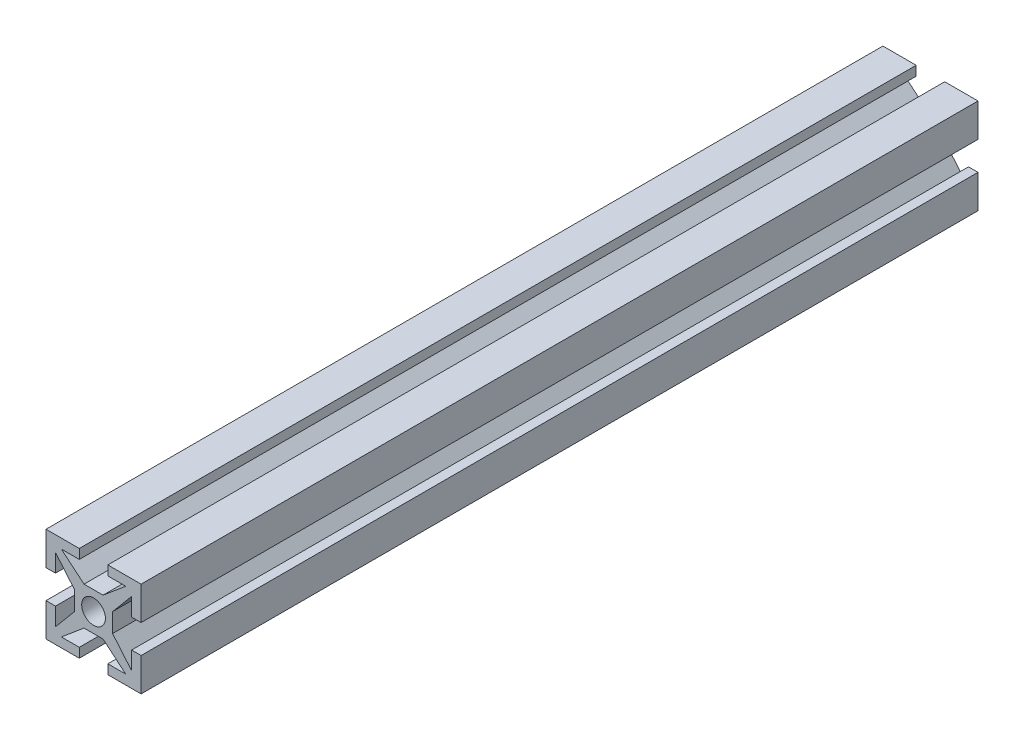
from build123d import *

# Parameters (mm, degrees)
ESQUISSE2_R        = 1.25
BOSS_EXTRU_1_DEPTH = 88


with BuildPart() as part:
    # Esquisse2 → Boss.-Extru.1 (new body)
    with BuildSketch(Plane.XY):
        Polygon((-1, -2), (1, -2), (3.383507185, -4), (1.5, -4), (1.5, -5), (5, -5), (5, -1.5), (4, -1.5), (4, -3.383507185), (2, -1), (2, 1), (4, 3.383507185), (4, 1.5), (5, 1.5), (5, 5), (1.5, 5), (1.5, 4), (3.383507185, 4), (1, 2), (-1, 2), (-3.383507185, 4), (-1.5, 4), (-1.5, 5), (-5, 5), (-5, 1.5), (-4, 1.5), (-4, 3.383507185), (-2, 1), (-2, -1), (-4, -3.383507185), (-4, -1.5), (-5, -1.5), (-5, -5), (-1.5, -5), (-1.5, -4), (-3.383507185, -4), align=None)
        Circle(ESQUISSE2_R, mode=Mode.SUBTRACT)
    extrude(amount=BOSS_EXTRU_1_DEPTH)


solid = part.part
